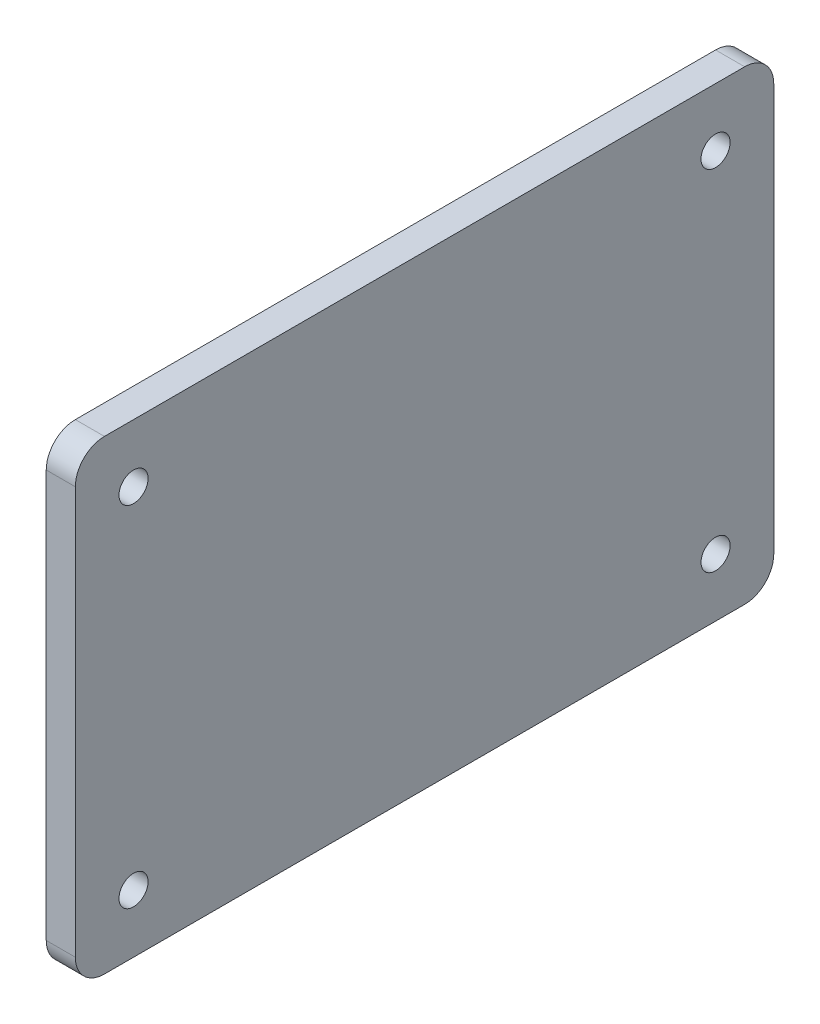
from build123d import *

# Parameters (mm, degrees)
SKETCH1_W                   = 152.4
SKETCH1_H                   = 101.6
BOSS_EXTRUDE1_DEPTH         = 6.35
F_1_4_0_25_DIAMETER_HOLE1_D = 6.35
LPATTERN1_COUNT             = 2
LPATTERN1_PITCH             = 76.2
LPATTERN1_COUNT_DIR2        = 2
LPATTERN1_PITCH_DIR2        = 127
FILLET1_R                   = 6.35


with BuildPart() as part:
    # Sketch1 → Boss-Extrude1 (new body)
    with BuildSketch(Plane.ZY.offset(323.85)):
        with Locations((-342.9, 69.85)):
            Rectangle(SKETCH1_W, SKETCH1_H)
    extrude(amount=BOSS_EXTRUDE1_DEPTH)

    # 1/4 (0.25) Diameter Hole1 (through all)
    with Locations(Plane.ZY.offset(330.2)):
        with Locations((-406.4, 31.75)):
            f_1_4_0_25_diameter_hole1 = Hole(F_1_4_0_25_DIAMETER_HOLE1_D / 2)

    # LPattern1: 1_4 _0.25_ Diameter Hole1 2 × 2
    with Locations(*[(0, i * LPATTERN1_PITCH, j * LPATTERN1_PITCH_DIR2) for i in range(LPATTERN1_COUNT) for j in range(LPATTERN1_COUNT_DIR2) if (i, j) != (0, 0)]):
        add(f_1_4_0_25_diameter_hole1, mode=Mode.SUBTRACT)

    # Fillet1
    fillet1_edges = [part.edges().sort_by_distance(p)[0] for p in [
        (-327.025, 120.65, -266.7),
        (-327.025, 19.05, -266.7),
        (-327.025, 19.05, -419.1),
        (-327.025, 120.65, -419.1),
    ]]
    fillet(fillet1_edges, radius=FILLET1_R)


solid = part.part
